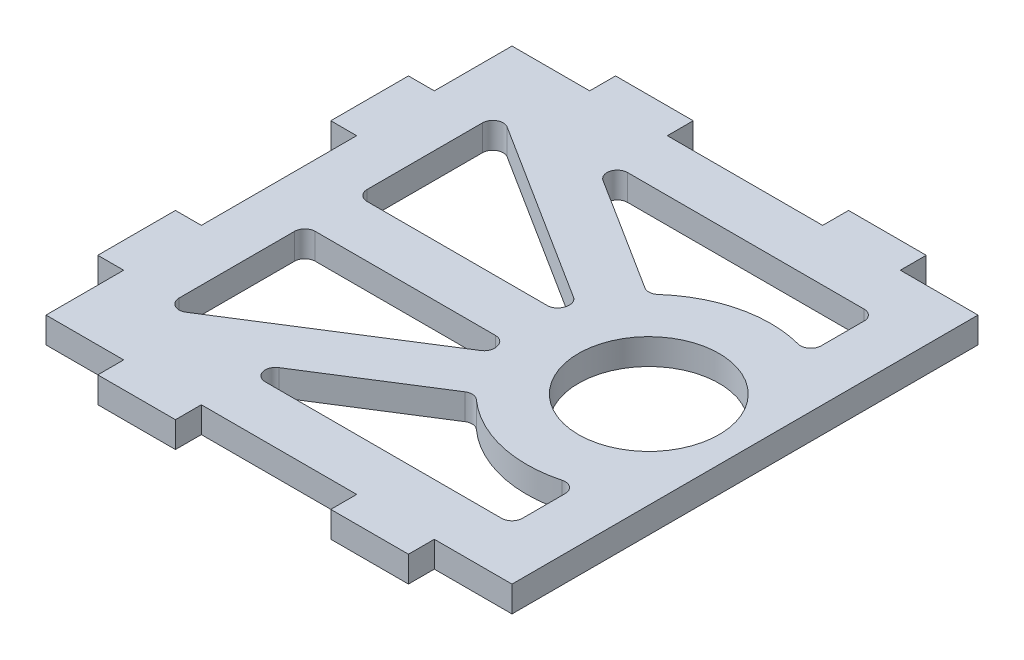
from build123d import *

# Parameters (mm, degrees)
BOSS_EXTRUDE1_DEPTH = 6.35
SKETCH2_R           = 17.250029
CUT_EXTRUDE1_DEPTH  = 167.316670842
CUT_EXTRUDE2_DEPTH  = 167.316670842
FILLET1_R           = 2.54


with BuildPart() as part:
    # Sketch1 → Boss-Extrude1 (new body)
    with BuildSketch(Plane(origin=(0, 0, 0), x_dir=(1, 0, 0), z_dir=(0, 1, 0))):
        Polygon((0, 0), (19.05, 0), (19.05, -6.35), (38.1, -6.35), (38.1, 0), (76.2, 0), (76.2, -6.35), (95.25, -6.35), (95.25, 0), (114.3, 0), (114.3, 114.3), (95.25, 114.3), (95.25, 120.65), (76.2, 120.65), (76.2, 114.3), (38.1, 114.3), (38.1, 120.65), (19.05, 120.65), (19.05, 114.3), (0, 114.3), (0, 95.25), (-6.35, 95.25), (-6.35, 76.2), (0, 76.2), (0, 38.1), (-6.35, 38.1), (-6.35, 19.05), (0, 19.05), align=None)
    extrude(amount=-BOSS_EXTRUDE1_DEPTH)

    # Sketch2 → Cut-Extrude1 (cut, through all)
    with BuildSketch(Plane(origin=(0, 0, 0), x_dir=(1, 0, 0), z_dir=(0, 1, 0))):
        with Locations((90.699971, 57.15)):
            Circle(SKETCH2_R)
    extrude(amount=-CUT_EXTRUDE1_DEPTH, mode=Mode.SUBTRACT)

    # Sketch3 → Cut-Extrude2 (cut, through all)
    with BuildSketch(Plane(origin=(0, 0, 0), x_dir=(1, 0, 0), z_dir=(0, 1, 0))):
        with BuildLine():
            ThreePointArc((61.430844995, 63.5), (61.932862595, 65.484129297), (62.569215567, 67.429340245))
            Line((62.569215567, 67.429340245), (12.7, 98.972041843))
            Line((12.7, 98.972041843), (12.7, 63.5))
            Line((12.7, 63.5), (61.430844995, 63.5))
        make_face()
        with BuildLine():
            Line((12.7, 15.327958157), (62.569215567, 46.870659755))
            ThreePointArc((62.569215567, 46.870659755), (61.932862595, 48.815870703), (61.430844995, 50.8))
            Line((61.430844995, 50.8), (12.7, 50.8))
            Line((12.7, 50.8), (12.7, 15.327958157))
        make_face()
        with BuildLine():
            ThreePointArc((101.6, 29.253878318), (84.446639415, 27.860068604), (69.358057015, 36.137457447))
            Line((69.358057015, 36.137457447), (32.303284959, 12.7))
            Line((32.303284959, 12.7), (101.6, 12.7))
            Line((101.6, 12.7), (101.6, 29.253878318))
        make_face()
        with BuildLine():
            Line((32.303284959, 101.6), (69.358057015, 78.162542553))
            ThreePointArc((69.358057015, 78.162542553), (84.446639415, 86.439931396), (101.6, 85.046121682))
            Line((101.6, 85.046121682), (101.6, 101.6))
            Line((101.6, 101.6), (32.303284959, 101.6))
        make_face()
    extrude(amount=-CUT_EXTRUDE2_DEPTH, mode=Mode.SUBTRACT)

    # Fillet1
    fillet1_edges = [part.edges().sort_by_distance(p)[0] for p in [
        (61.430844995, -3.175, -63.5),
        (12.7, -3.175, -63.5),
        (62.569215567, -3.175, -67.429340245),
        (101.6, -3.175, -29.253878318),
        (101.6, -3.175, -12.7),
        (32.303284959, -3.175, -12.7),
        (69.358057015, -3.175, -36.137457447),
        (69.358057015, -3.175, -78.162542553),
        (32.303284959, -3.175, -101.6),
        (101.6, -3.175, -101.6),
        (101.6, -3.175, -85.046121682),
        (62.569215567, -3.175, -46.870659755),
        (12.7, -3.175, -15.327958157),
        (12.7, -3.175, -50.8),
        (61.430844995, -3.175, -50.8),
        (12.7, -3.175, -98.972041843),
    ]]
    fillet(fillet1_edges, radius=FILLET1_R)


solid = part.part
